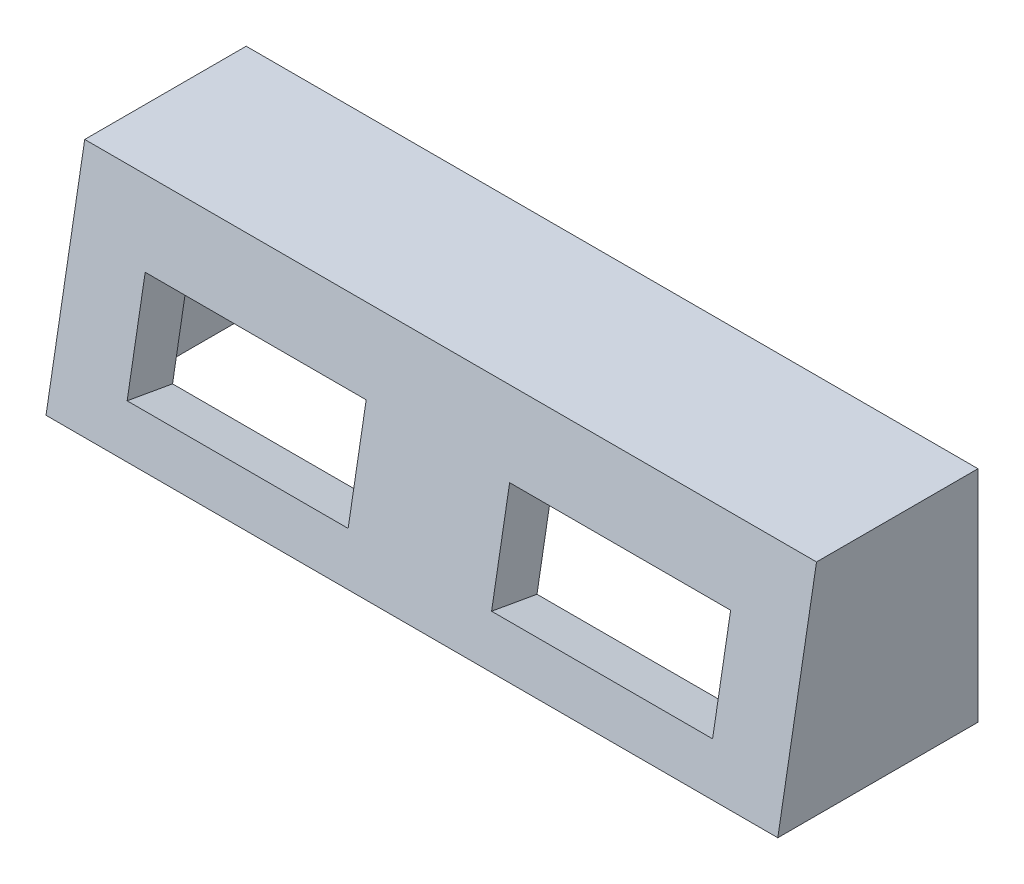
from build123d import *

# Parameters (mm, degrees)
SKETCH1_W               = 100
SKETCH1_H               = 45
BOSS_EXTRUDE1_DEPTH     = 30
CUT_EXTRUDE5_DEPTH      = 107.800046816
SKETCH2_W               = 30.2
SKETCH2_H               = 14.2
CUT_EXTRUDE1_DEPTH      = 61.848905169
CUT_EXTRUDE6_REACH      = 64.5
SKETCH9_W               = 96
SKETCH9_H               = 41
SHELL2_START            = -48
SHELL2_DEPTH            = 96
SHELL2_START_2          = -7.8
SHELL2_2_DEPTH          = 15.6
SHELL2_3_DEPTH          = 6
SHELL2_START_3          = 42
SHELL2_4_DEPTH          = 6
SKETCH10_W              = 96
SKETCH10_H              = 2
CUT_EXTRUDE7_DEPTH      = 2
CUT_EXTRUDE9_START      = -1.5
SKETCH12_W              = 1.25
SKETCH12_H              = 3
CUT_EXTRUDE9_DEPTH      = 3
LPATTERN2_COUNT         = 2
LPATTERN2_PITCH         = 15
LPATTERN3_COUNT         = 2
LPATTERN3_PITCH         = 5
LPATTERN4_COUNT         = 2
LPATTERN4_PITCH         = 20
MIRROR7_START           = -1.5
MIRROR7_COPY_1_SKETCH_W = 1.25
MIRROR7_COPY_1_SKETCH_H = 3
MIRROR7_COPY_1_DEPTH    = 3
MIRROR7_COPY_2_SKETCH_W = 1.25
MIRROR7_COPY_2_SKETCH_H = 3
MIRROR7_COPY_2_DEPTH    = 3
MIRROR7_COPY_3_SKETCH_W = 1.25
MIRROR7_COPY_3_SKETCH_H = 3
MIRROR7_COPY_3_DEPTH    = 3
CHAMFER4_SIZE           = 1
SKETCH13_W              = 30
SKETCH13_H              = 15
CUT_EXTRUDE10_DEPTH     = 107.800046816
CHAMFER5_SIZE           = 0.6
SKETCH14_W              = 2
SKETCH14_H              = 14.2
CUT_EXTRUDE11_DEPTH     = 3.5


# Read off the part's stored shape, not the designer's step: Shell2
with BuildPart() as part:
    # Sketch1 → Boss-Extrude1 (new body)
    with BuildSketch(Plane.XY):
        Rectangle(SKETCH1_W, SKETCH1_H)
    extrude(amount=BOSS_EXTRUDE1_DEPTH)

    # Sketch7 → Cut-Extrude5 (cut, through all)
    with BuildSketch(Plane(origin=(50, 0, 0), x_dir=(0, 0, -1), z_dir=(1, 0, 0))):
        Polygon((-30, -22.5), (-22.065285868, 22.5), (-30, 22.5), align=None)
    extrude(amount=-CUT_EXTRUDE5_DEPTH, mode=Mode.SUBTRACT)

    # Sketch2 → Cut-Extrude1 (cut, through all)
    with BuildSketch(Plane(origin=(0, -0.341825557, 26.092916002), x_dir=(1, 0, 0), z_dir=(0, 0.17364817766692325, 0.9848077530122092))):
        with Locations((-24.9, 6.094197535)):
            Rectangle(SKETCH2_W, SKETCH2_H)
    cut_extrude1 = extrude(amount=-CUT_EXTRUDE1_DEPTH, mode=Mode.SUBTRACT)

    # Mirror1: Cut-Extrude1 across plane
    add(cut_extrude1.mirror(Plane(origin=(0, 0, 0), x_dir=(0, 0, 1), z_dir=(1, 0, 0))), mode=Mode.SUBTRACT)

    # Cut-Extrude6: up to this plane
    cut_extrude6_end = Plane(origin=(-50, -23.767631697, 22.810903403), z_dir=(0, -0.17364817766692328, -0.9848077530122092))
    # Sketch9 → Cut-Extrude6 (cut, up to the surface)
    with BuildSketch(Plane(origin=(0, 0, 0), x_dir=(-1, 0, 0), z_dir=(0, 0, -1)), mode=Mode.PRIVATE) as cut_extrude6_sk1:
        Rectangle(SKETCH9_W, SKETCH9_H)
    cut_extrude6_tool1 = split(extrude(cut_extrude6_sk1.sketch, amount=-CUT_EXTRUDE6_REACH, mode=Mode.PRIVATE), bisect_by=cut_extrude6_end, keep=Keep.BOTH, mode=Mode.PRIVATE)
    add(cut_extrude6_tool1.solids().sort_by_distance((0, 0, 0))[0], mode=Mode.SUBTRACT)

    # Shell2 outline → Shell2 (cut)
    with BuildSketch(Plane.YZ.offset(SHELL2_START)):
        Polygon((13.353906279, 16.265374693), (20.5, 15.005325563), (20.5, 20.387086606), (14.274241621, 21.484855784), align=None)
        Polygon((-20.5, 22.234731772), (-4.569594826, 19.425771526), (-3.649259484, 24.645252617), (-22.5, 27.969146776), (-22.5, 2), (-20.5, 2), align=None)
    extrude(amount=SHELL2_DEPTH, mode=Mode.SUBTRACT)

    # Shell2 2 outline → Shell2 2 (cut)
    with BuildSketch(Plane.YZ.offset(SHELL2_START_2)):
        Polygon((-4.569594826, 19.425771526), (13.353906279, 16.265374693), (14.274241621, 21.484855783), (-3.649259484, 24.645252617), align=None)
    extrude(amount=SHELL2_2_DEPTH, mode=Mode.SUBTRACT)

    # Shell2 3 outline → Shell2 3 (cut)
    with BuildSketch(Plane.YZ.offset(SHELL2_START)):
        Polygon((-4.569594826, 19.425771526), (13.353906279, 16.265374693), (14.274241621, 21.484855783), (-3.649259484, 24.645252617), align=None)
    extrude(amount=SHELL2_3_DEPTH, mode=Mode.SUBTRACT)

    # Shell2 4 outline → Shell2 4 (cut)
    with BuildSketch(Plane.YZ.offset(SHELL2_START_3)):
        Polygon((-4.569594826, 19.425771526), (13.353906279, 16.265374693), (14.274241621, 21.484855783), (-3.649259484, 24.645252617), align=None)
    extrude(amount=SHELL2_4_DEPTH, mode=Mode.SUBTRACT)

    # Sketch10 → Cut-Extrude7 (cut)
    with BuildSketch(Plane(origin=(0, 0, 0), x_dir=(-1, 0, 0), z_dir=(0, 0, -1))):
        with Locations((0, -21.5)):
            Rectangle(SKETCH10_W, SKETCH10_H)
    extrude(amount=-CUT_EXTRUDE7_DEPTH, mode=Mode.SUBTRACT)

    # Sketch12 → Cut-Extrude9 (cut)
    with BuildSketch(Plane(origin=(0, 0, 0), x_dir=(-1, 0, 0), z_dir=(0, 0, -1)).offset(CUT_EXTRUDE9_START)):
        with Locations((48.625, -4.5)):
            Rectangle(SKETCH12_W, SKETCH12_H)
    cut_extrude9 = extrude(amount=-CUT_EXTRUDE9_DEPTH, mode=Mode.SUBTRACT)

    # LPattern2: Cut-Extrude9 ×2
    with Locations(*[(0, 0, i * LPATTERN2_PITCH) for i in range(1, LPATTERN2_COUNT)]):
        add(cut_extrude9, mode=Mode.SUBTRACT)

    # LPattern3: Cut-Extrude9 ×2
    with Locations(*[(0, i * LPATTERN3_PITCH, 0) for i in range(1, LPATTERN3_COUNT)]):
        add(cut_extrude9, mode=Mode.SUBTRACT)

    # LPattern4: Cut-Extrude9 ×2
    with Locations(*[(0, i * LPATTERN4_PITCH, 0) for i in range(1, LPATTERN4_COUNT)]):
        add(cut_extrude9, mode=Mode.SUBTRACT)

    # Mirror7: Cut-Extrude9 across plane
    add(cut_extrude9.mirror(Plane(origin=(0, 0, 0), x_dir=(0, 0, 1), z_dir=(1, 0, 0))), mode=Mode.SUBTRACT)

    # Mirror7 copy 1 sketch → Mirror7 copy 1 (cut)
    with BuildSketch(Plane(origin=(0, 0, 15), x_dir=(1, 0, 0), z_dir=(0, 0, -1)).offset(MIRROR7_START)):
        with Locations((48.625, 4.5)):
            Rectangle(MIRROR7_COPY_1_SKETCH_W, MIRROR7_COPY_1_SKETCH_H)
    extrude(amount=-MIRROR7_COPY_1_DEPTH, mode=Mode.SUBTRACT)

    # Mirror7 copy 2 sketch → Mirror7 copy 2 (cut)
    with BuildSketch(Plane(origin=(0, 5, 0), x_dir=(1, 0, 0), z_dir=(0, 0, -1)).offset(MIRROR7_START)):
        with Locations((48.625, 4.5)):
            Rectangle(MIRROR7_COPY_2_SKETCH_W, MIRROR7_COPY_2_SKETCH_H)
    extrude(amount=-MIRROR7_COPY_2_DEPTH, mode=Mode.SUBTRACT)

    # Mirror7 copy 3 sketch → Mirror7 copy 3 (cut)
    with BuildSketch(Plane(origin=(0, 20, 0), x_dir=(1, 0, 0), z_dir=(0, 0, -1)).offset(MIRROR7_START)):
        with Locations((48.625, 4.5)):
            Rectangle(MIRROR7_COPY_3_SKETCH_W, MIRROR7_COPY_3_SKETCH_H)
    extrude(amount=-MIRROR7_COPY_3_DEPTH, mode=Mode.SUBTRACT)

    # Chamfer4
    chamfer4_edges = [part.edges().sort_by_distance(p)[0] for p in [
        (24.9, -2.59997932, 19.078475171),
        (9.8, 4.392155727, 17.845573109),
        (24.9, 11.384290773, 16.612671048),
        (40, 4.392155727, 17.845573109),
        (-24.9, -2.59997932, 19.078475171),
        (-9.8, 4.392155727, 17.845573109),
        (-24.9, 11.384290773, 16.612671048),
        (-40, 4.392155727, 17.845573109),
    ]]
    chamfer(chamfer4_edges, length=CHAMFER4_SIZE)

    # Sketch13 → Cut-Extrude10 (cut, through all)
    with BuildSketch(Plane.ZY.offset(50)):
        with Locations((15, -15)):
            Rectangle(SKETCH13_W, SKETCH13_H)
    extrude(amount=-CUT_EXTRUDE10_DEPTH, mode=Mode.SUBTRACT)

    # Chamfer5
    chamfer5_edges = [part.edges().sort_by_distance(p)[0] for p in [
        (-49.25, -4.5, 4.5),
        (-49.25, -4.5, 19.5),
        (49.25, -4.5, 4.5),
        (49.25, -4.5, 19.5),
    ]]
    chamfer(chamfer5_edges, length=CHAMFER5_SIZE)

    # Sketch14 → Cut-Extrude11 (cut)
    with BuildSketch(Plane(origin=(0, 3.184212437, 18.058566102), x_dir=(-1, 0, 0), z_dir=(0, -0.17364817766692328, -0.9848077530122094))):
        with Locations((8.8, 1.226577762)):
            Rectangle(SKETCH14_W, SKETCH14_H)
        with Locations((-41, 1.226577762)):
            Rectangle(SKETCH14_W, SKETCH14_H)
    extrude(amount=-CUT_EXTRUDE11_DEPTH, mode=Mode.SUBTRACT)


solid = part.part
